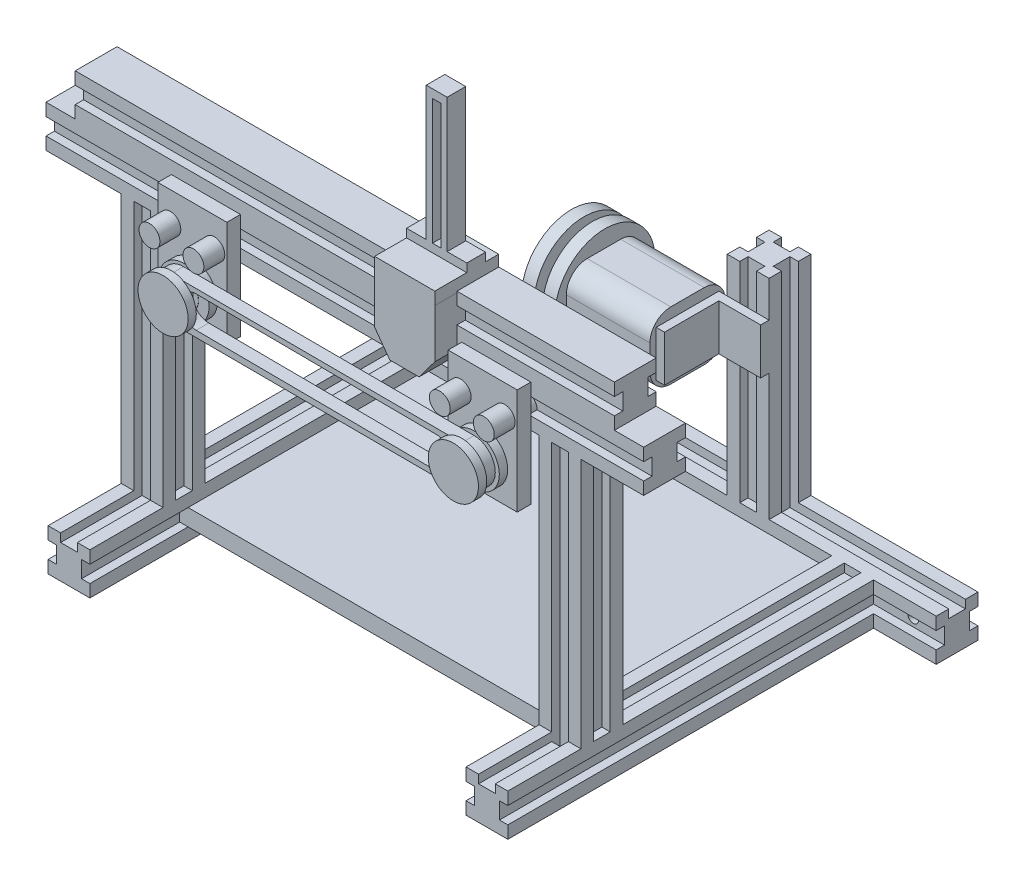
from build123d import *

# Parameters (mm, degrees)
SKETCH_1_W                = 10
SKETCH_1_H                = 35
EXTRUDE_1_DEPTH           = 10
EXTRUDE_2_DEPTH           = 60
EXTRUDE_2_DEPTH_BACK      = 10
SKETCH_2_W                = 10
SKETCH_2_H                = 10
SKETCH_3_W                = 4
SKETCH_3_H                = 35
CUT_EXTRUDE_1_DEPTH       = 2
SKETCH_5_W                = 4
SKETCH_5_H                = 62
CUT_EXTRUDE_2_DEPTH       = 2
SKETCH_6_W                = 10
SKETCH_6_H                = 10
EXTRUDE_3_DEPTH           = 10
SKETCH_7_W                = 10
SKETCH_7_H                = 10
EXTRUDE_4_DEPTH           = 18
SKETCH_9_W                = 10
SKETCH_9_H                = 10
EXTRUDE_6_DEPTH           = 100
SKETCH_10_W               = 4
SKETCH_10_H               = 70
CUT_EXTRUDE_3_DEPTH       = 2
SKETCH_12_W               = 10
SKETCH_12_H               = 10
EXTRUDE_8_DEPTH           = 60
SKETCH_13_W               = 4
SKETCH_13_H               = 60
CUT_EXTRUDE_4_DEPTH       = 2
SKETCH_14_W               = 10
SKETCH_14_H               = 10
EXTRUDE_9_DEPTH           = 10
SKETCH_15_W               = 10
SKETCH_15_H               = 10
EXTRUDE_10_DEPTH          = 15
SKETCH_17_W               = 10
SKETCH_17_H               = 10
EXTRUDE_12_DEPTH          = 100
SKETCH_18_W               = 10
SKETCH_18_H               = 10
EXTRUDE_13_DEPTH          = 50
SKETCH_19_W               = 4
SKETCH_19_H               = 50
CUT_EXTRUDE_5_DEPTH       = 2
SKETCH_21_W               = 12
SKETCH_21_H               = 11
EXTRUDE_14_DEPTH          = 2
SKETCH_22_W               = 2
SKETCH_22_H               = 11
EXTRUDE_15_DEPTH          = 15
SKETCH_26_W               = 10
SKETCH_26_H               = 10
EXTRUDE_18_DEPTH          = 60
SKETCH_27_W               = 10
SKETCH_27_H               = 10
EXTRUDE_19_DEPTH          = 15
SKETCH_29_W               = 90
SKETCH_29_H               = 4
CUT_EXTRUDE_6_DEPTH       = 2
SKETCH_30_W               = 4
SKETCH_30_H               = 50
CUT_EXTRUDE_7_DEPTH       = 2
SKETCH_31_W               = 4
SKETCH_31_H               = 52
CUT_EXTRUDE_8_DEPTH       = 2
SKETCH_32_W               = 42
SKETCH_32_H               = 4
CUT_EXTRUDE_9_DEPTH       = 2
SKETCH_33_W               = 128
SKETCH_33_H               = 4
CUT_EXTRUDE_10_DEPTH      = 2
SKETCH_34_W               = 10
SKETCH_34_H               = 10
EXTRUDE_21_DEPTH          = 72
SKETCH_35_W               = 10
SKETCH_35_H               = 10
EXTRUDE_22_DEPTH          = 15
SKETCH_37_W               = 10
SKETCH_37_H               = 4
CUT_EXTRUDE_11_DEPTH      = 2
SKETCH_38_W               = 4
SKETCH_38_H               = 70
CUT_EXTRUDE_12_DEPTH      = 2
SKETCH_40_W               = 10
SKETCH_40_H               = 10
EXTRUDE_23_DEPTH          = 35
SKETCH_41_W               = 4
SKETCH_41_H               = 35
SKETCH_41_H_2             = 60.179921859
CUT_EXTRUDE_13_DEPTH      = 2
CUT_EXTRUDE_14_DEPTH      = 92
CUT_EXTRUDE_14_DEPTH_BACK = 2
SKETCH_42_W               = 105
SKETCH_42_H               = 4
SKETCH_43_W               = 4
SKETCH_43_H               = 60
CUT_EXTRUDE_15_DEPTH      = 2
CUT_EXTRUDE_17_DEPTH      = 92
CUT_EXTRUDE_17_DEPTH_BACK = 2
SKETCH_45_W               = 4
SKETCH_45_H               = 60
SKETCH_48_W               = 143
SKETCH_48_H               = 4
SKETCH_48_W_2             = 140
SKETCH_48_W_3             = 4
SKETCH_48_H_2             = 50
CUT_EXTRUDE_19_DEPTH      = 2
SKETCH_49_W               = 143.017292897
SKETCH_49_H               = 4
CUT_EXTRUDE_20_DEPTH      = 2
SKETCH_50_W               = 94
SKETCH_50_H               = 4
CUT_EXTRUDE_21_DEPTH      = 2
SKETCH_51_W               = 5
SKETCH_51_H               = 4
CUT_EXTRUDE_22_DEPTH      = 2
CUT_EXTRUDE_25_DEPTH      = 24
CUT_EXTRUDE_25_DEPTH_BACK = 2
SKETCH_54_W               = 107
SKETCH_54_H               = 4
CUT_EXTRUDE_26_DEPTH      = 24
CUT_EXTRUDE_26_DEPTH_BACK = 2
SKETCH_55_W               = 107
SKETCH_55_H               = 4
SKETCH_56_R               = 1.25
CUT_EXTRUDE_27_DEPTH      = 81
SKETCH_57_W               = 4
SKETCH_57_H               = 59.985558993
CUT_EXTRUDE_28_DEPTH      = 2
SKETCH_64_W               = 94
SKETCH_64_H               = 4
EXTRUDE_29_DEPTH          = 66
SKETCH_65_W               = 110
SKETCH_65_H               = 17.5
CUT_EXTRUDE_30_DEPTH      = 175.086903586
SKETCH_66_W               = 16.527417389
SKETCH_66_H               = 25.328727671
EXTRUDE_30_DEPTH          = 6.5
SKETCH_68_W               = 16.527417389
SKETCH_68_H               = 3.25
CUT_EXTRUDE_32_DEPTH      = 175.086903586
SKETCH_69_R               = 2.5
EXTRUDE_31_DEPTH          = 5
SKETCH_70_R               = 6
EXTRUDE_32_DEPTH          = 2
SKETCH_71_R               = 3.5
EXTRUDE_33_DEPTH          = 3
SKETCH_72_R               = 6
EXTRUDE_34_DEPTH          = 2
SKETCH_78_W               = 16.53
SKETCH_78_H               = 3.25
EXTRUDE_38_DEPTH          = 29
EXTRUDE_39_DEPTH          = 5
EXTRUDE_39_DEPTH_BACK     = 9
SKETCH_79_R               = 2.5
SKETCH_80_W               = 16.53
SKETCH_80_H               = 3.671272329
CUT_EXTRUDE_33_DEPTH      = 5
SKETCH_84_R               = 6
EXTRUDE_43_DEPTH          = 2
SKETCH_85_R               = 3.5
EXTRUDE_44_DEPTH          = 3
SKETCH_86_R               = 6
EXTRUDE_45_DEPTH          = 2
EXTRUDE_46_DEPTH          = 3
CUT_EXTRUDE_34_DEPTH      = 3
SKETCH_90_W               = 129.003731319
SKETCH_90_H               = 10
EXTRUDE_47_DEPTH          = 10
SKETCH_91_W               = 129.750613008
SKETCH_91_H               = 4
CUT_EXTRUDE_35_DEPTH      = 2
SKETCH_92_W               = 134.507780813
SKETCH_92_H               = 4
CUT_EXTRUDE_36_DEPTH      = 2
EXTRUDE_49_DEPTH          = 12
SKETCH_95_W               = 14.403024518
SKETCH_95_H               = 5.3
EXTRUDE_50_DEPTH          = 3
SKETCH_96_W               = 14.403024518
SKETCH_96_H               = 2.667341582
EXTRUDE_51_DEPTH          = 10
SKETCH_97_W               = 14.403024518
SKETCH_97_H               = 4.481182928
EXTRUDE_52_DEPTH          = 2
SKETCH_98_W               = 5
SKETCH_98_H               = 4.446887226
EXTRUDE_53_DEPTH          = 32
SKETCH_99_W               = 18
SKETCH_99_H               = 16
EXTRUDE_54_DEPTH          = 20
FILLET_1_R                = 5
SKETCH_100_R              = 11.938572067
EXTRUDE_55_DEPTH          = 3
SKETCH_101_R              = 7.602426979
EXTRUDE_56_DEPTH          = 2
SKETCH_102_R              = 11.938572067
EXTRUDE_57_DEPTH          = 3
SKETCH_103_R              = 7.369837634
EXTRUDE_58_DEPTH          = 3
SKETCH_104_W              = 5.901682188
SKETCH_104_H              = 2.792537945
CUT_EXTRUDE_37_DEPTH      = 69
SKETCH_106_W              = 2
SKETCH_106_H              = 30
CUT_EXTRUDE_38_DEPTH      = 10


with BuildPart() as part:
    # 草圖1 → 填料-伸長1 (new body)
    with BuildSketch(Plane(origin=(0, 0, 0), x_dir=(1, 0, 0), z_dir=(0, 1, 0))):
        Rectangle(SKETCH_1_W, SKETCH_1_H)
    extrude(amount=EXTRUDE_1_DEPTH)

    # 草圖2 → 填料-伸長2 (add, two sides: drawn at the far end of the back side and taken through both)
    with BuildSketch(Plane(origin=(0, 10, 0), x_dir=(1, 0, 0), z_dir=(0, 1, 0)).offset(-EXTRUDE_2_DEPTH_BACK)):
        with Locations((0, 22.5)):
            Rectangle(SKETCH_2_W, SKETCH_2_H)
    extrude(amount=EXTRUDE_2_DEPTH + EXTRUDE_2_DEPTH_BACK)

    # 草圖3 → 除料-伸長1 (cut)
    with BuildSketch(Plane(origin=(0, 10, 0), x_dir=(1, 0, 0), z_dir=(0, 1, 0))):
        Rectangle(SKETCH_3_W, SKETCH_3_H)
    extrude(amount=-CUT_EXTRUDE_1_DEPTH, mode=Mode.SUBTRACT)

    # 草圖5 → 除料-伸長2 (cut)
    with BuildSketch(Plane.XY.offset(-17.5)):
        with Locations((0, 39)):
            Rectangle(SKETCH_5_W, SKETCH_5_H)
    extrude(amount=-CUT_EXTRUDE_2_DEPTH, mode=Mode.SUBTRACT)

    # 草圖6 → 填料-伸長3 (add)
    with BuildSketch(Plane(origin=(0, 70, 0), x_dir=(1, 0, 0), z_dir=(0, 1, 0))):
        with Locations((0, 22.5)):
            Rectangle(SKETCH_6_W, SKETCH_6_H)
    extrude(amount=EXTRUDE_3_DEPTH)

    # 草圖7 → 填料-伸長4 (add)
    with BuildSketch(Plane.ZY.offset(5)):
        with Locations((-22.5, 75)):
            Rectangle(SKETCH_7_W, SKETCH_7_H)
    extrude(amount=EXTRUDE_4_DEPTH)

    # 草圖9 → 填料-伸長6 (add)
    with BuildSketch(Plane(origin=(5, 0, 0), x_dir=(0, 0, -1), z_dir=(1, 0, 0))):
        with Locations((22.5, 75)):
            Rectangle(SKETCH_9_W, SKETCH_9_H)
    extrude(amount=EXTRUDE_6_DEPTH)

    # 草圖10 → 除料-伸長3 (cut)
    with BuildSketch(Plane(origin=(0, 0, -27.5), x_dir=(-1, 0, 0), z_dir=(0, 0, -1))):
        with Locations((0, 35)):
            Rectangle(SKETCH_10_W, SKETCH_10_H)
    extrude(amount=-CUT_EXTRUDE_3_DEPTH, mode=Mode.SUBTRACT)

    # 草圖12 → 填料-伸長8 (add)
    with BuildSketch(Plane(origin=(0, 0, -27.5), x_dir=(-1, 0, 0), z_dir=(0, 0, -1))):
        with Locations((0, 5)):
            Rectangle(SKETCH_12_W, SKETCH_12_H)
    extrude(amount=EXTRUDE_8_DEPTH)

    # 草圖13 → 除料-伸長4 (cut)
    with BuildSketch(Plane(origin=(0, 10, 0), x_dir=(1, 0, 0), z_dir=(0, 1, 0))):
        with Locations((0, 57.5)):
            Rectangle(SKETCH_13_W, SKETCH_13_H)
    extrude(amount=-CUT_EXTRUDE_4_DEPTH, mode=Mode.SUBTRACT)

    # 草圖14 → 填料-伸長9 (add)
    with BuildSketch(Plane(origin=(0, 0, -87.5), x_dir=(-1, 0, 0), z_dir=(0, 0, -1))):
        with Locations((0, 5)):
            Rectangle(SKETCH_14_W, SKETCH_14_H)
    extrude(amount=EXTRUDE_9_DEPTH)

    # 草圖15 → 填料-伸長10 (add)
    with BuildSketch(Plane.ZY.offset(5)):
        with Locations((-92.5, 5)):
            Rectangle(SKETCH_15_W, SKETCH_15_H)
    extrude(amount=EXTRUDE_10_DEPTH)

    # 草圖17 → 填料-伸長12 (add)
    with BuildSketch(Plane(origin=(5, 0, 0), x_dir=(0, 0, -1), z_dir=(1, 0, 0))):
        with Locations((92.5, 5)):
            Rectangle(SKETCH_17_W, SKETCH_17_H)
    extrude(amount=EXTRUDE_12_DEPTH)

    # 草圖18 → 填料-伸長13 (add)
    with BuildSketch(Plane(origin=(0, 10, 0), x_dir=(1, 0, 0), z_dir=(0, 1, 0))):
        with Locations((75, 92.5)):
            Rectangle(SKETCH_18_W, SKETCH_18_H)
    extrude(amount=EXTRUDE_13_DEPTH)

    # 草圖19 → 除料-伸長5 (cut)
    with BuildSketch(Plane.XY.offset(-87.5)):
        with Locations((75, 35)):
            Rectangle(SKETCH_19_W, SKETCH_19_H)
    extrude(amount=-CUT_EXTRUDE_5_DEPTH, mode=Mode.SUBTRACT)

    # 草圖21 → 填料-伸長14 (add)
    with BuildSketch(Plane.XY.offset(-87.5)):
        with Locations((74, 45.84296249)):
            Rectangle(SKETCH_21_W, SKETCH_21_H)
    extrude(amount=EXTRUDE_14_DEPTH)

    # 草圖22 → 填料-伸長15 (add)
    with BuildSketch(Plane(origin=(0, 0, -87.5), x_dir=(-1, 0, 0), z_dir=(0, 0, -1))):
        with Locations((-69, 45.84296249)):
            Rectangle(SKETCH_22_W, SKETCH_22_H)
    extrude(amount=-EXTRUDE_15_DEPTH)

    # 草圖26 → 填料-伸長18 (add)
    with BuildSketch(Plane.XY.offset(-87.5)):
        with Locations((100, 5)):
            Rectangle(SKETCH_26_W, SKETCH_26_H)
    extrude(amount=EXTRUDE_18_DEPTH)

    # 草圖27 → 填料-伸長19 (add)
    with BuildSketch(Plane(origin=(105, 0, 0), x_dir=(0, 0, -1), z_dir=(1, 0, 0))):
        with Locations((92.5, 5)):
            Rectangle(SKETCH_27_W, SKETCH_27_H)
    extrude(amount=EXTRUDE_19_DEPTH)

    # 草圖29 → 除料-伸長6 (cut)
    with BuildSketch(Plane(origin=(0, 10, 0), x_dir=(1, 0, 0), z_dir=(0, 1, 0))):
        with Locations((25, 92.5)):
            Rectangle(SKETCH_29_W, SKETCH_29_H)
    extrude(amount=-CUT_EXTRUDE_6_DEPTH, mode=Mode.SUBTRACT)

    # 草圖30 → 除料-伸長7 (cut)
    with BuildSketch(Plane(origin=(80, 0, 0), x_dir=(0, 0, -1), z_dir=(1, 0, 0))):
        with Locations((92.5, 35)):
            Rectangle(SKETCH_30_W, SKETCH_30_H)
    extrude(amount=-CUT_EXTRUDE_7_DEPTH, mode=Mode.SUBTRACT)

    # 草圖31 → 除料-伸長8 (cut)
    with BuildSketch(Plane.ZY.offset(-70)):
        with Locations((-92.5, 34)):
            Rectangle(SKETCH_31_W, SKETCH_31_H)
    extrude(amount=-CUT_EXTRUDE_8_DEPTH, mode=Mode.SUBTRACT)

    # 草圖32 → 除料-伸長9 (cut)
    with BuildSketch(Plane(origin=(0, 10, 0), x_dir=(1, 0, 0), z_dir=(0, 1, 0))):
        with Locations((99, 92.5)):
            Rectangle(SKETCH_32_W, SKETCH_32_H)
    extrude(amount=-CUT_EXTRUDE_9_DEPTH, mode=Mode.SUBTRACT)

    # 草圖33 → 除料-伸長10 (cut)
    with BuildSketch(Plane.XY.offset(-17.5)):
        with Locations((41, 75)):
            Rectangle(SKETCH_33_W, SKETCH_33_H)
    extrude(amount=-CUT_EXTRUDE_10_DEPTH, mode=Mode.SUBTRACT)

    # 草圖34 → 填料-伸長21 (add)
    with BuildSketch(Plane.XZ):
        with Locations((100, -22.5)):
            Rectangle(SKETCH_34_W, SKETCH_34_H)
    extrude(amount=-EXTRUDE_21_DEPTH)

    # 草圖35 → 填料-伸長22 (add)
    with BuildSketch(Plane(origin=(105, 0, 0), x_dir=(0, 0, -1), z_dir=(1, 0, 0))):
        with Locations((22.5, 75)):
            Rectangle(SKETCH_35_W, SKETCH_35_H)
    extrude(amount=EXTRUDE_22_DEPTH)

    # 草圖37 → 除料-伸長11 (cut)
    with BuildSketch(Plane.XY.offset(-17.5)):
        with Locations((110, 75)):
            Rectangle(SKETCH_37_W, SKETCH_37_H)
    extrude(amount=-CUT_EXTRUDE_11_DEPTH, mode=Mode.SUBTRACT)

    # 草圖38 → 除料-伸長12 (cut)
    with BuildSketch(Plane.XY.offset(-17.5)):
        with Locations((100, 35)):
            Rectangle(SKETCH_38_W, SKETCH_38_H)
    extrude(amount=-CUT_EXTRUDE_12_DEPTH, mode=Mode.SUBTRACT)

    # 草圖40 → 填料-伸長23 (add)
    with BuildSketch(Plane.XY.offset(-17.5)):
        with Locations((100, 5)):
            Rectangle(SKETCH_40_W, SKETCH_40_H)
    extrude(amount=EXTRUDE_23_DEPTH)

    # 草圖41 → 除料-伸長13 (cut)
    with BuildSketch(Plane(origin=(0, 10, 0), x_dir=(1, 0, 0), z_dir=(0, 1, 0))):
        with Locations((100, 0)):
            Rectangle(SKETCH_41_W, SKETCH_41_H)
        with Locations((100, 57.410039071)):
            Rectangle(SKETCH_41_W, SKETCH_41_H_2)
    extrude(amount=-CUT_EXTRUDE_13_DEPTH, mode=Mode.SUBTRACT)

    # 草圖42 → 除料-伸長14 (cut, two sides: drawn at the far end of the back side and taken through both)
    with BuildSketch(Plane(origin=(5, 0, 0), x_dir=(0, 0, -1), z_dir=(1, 0, 0)).offset(-CUT_EXTRUDE_14_DEPTH_BACK)):
        with Locations((35, 5)):
            Rectangle(SKETCH_42_W, SKETCH_42_H)
    extrude(amount=CUT_EXTRUDE_14_DEPTH + CUT_EXTRUDE_14_DEPTH_BACK, mode=Mode.SUBTRACT)

    # 草圖43 → 除料-伸長15 (cut)
    with BuildSketch(Plane(origin=(0, 0, -27.5), x_dir=(-1, 0, 0), z_dir=(0, 0, -1))):
        with Locations((-100, 40)):
            Rectangle(SKETCH_43_W, SKETCH_43_H)
    extrude(amount=-CUT_EXTRUDE_15_DEPTH, mode=Mode.SUBTRACT)

    # 草圖45 → 除料-伸長17 (cut, two sides: drawn at the far end of the back side and taken through both)
    with BuildSketch(Plane(origin=(5, 0, 0), x_dir=(0, 0, -1), z_dir=(1, 0, 0)).offset(-CUT_EXTRUDE_17_DEPTH_BACK)):
        with Locations((22.5, 40)):
            Rectangle(SKETCH_45_W, SKETCH_45_H)
    extrude(amount=CUT_EXTRUDE_17_DEPTH + CUT_EXTRUDE_17_DEPTH_BACK, mode=Mode.SUBTRACT)

    # 草圖48 → 除料-伸長19 (cut)
    with BuildSketch(Plane(origin=(0, 0, -97.5), x_dir=(-1, 0, 0), z_dir=(0, 0, -1))):
        with Locations((-48.5, 75)):
            Rectangle(SKETCH_48_W, SKETCH_48_H)
        with Locations((-50, 5)):
            Rectangle(SKETCH_48_W_2, SKETCH_48_H)
        with Locations((-75, 35)):
            Rectangle(SKETCH_48_W_3, SKETCH_48_H_2)
    extrude(amount=-CUT_EXTRUDE_19_DEPTH, mode=Mode.SUBTRACT)

    # 草圖49 → 除料-伸長20 (cut)
    with BuildSketch(Plane(origin=(0, 0, -27.5), x_dir=(-1, 0, 0), z_dir=(0, 0, -1))):
        with Locations((-48.508646449, 75)):
            Rectangle(SKETCH_49_W, SKETCH_49_H)
    extrude(amount=-CUT_EXTRUDE_20_DEPTH, mode=Mode.SUBTRACT)

    # 草圖50 → 除料-伸長21 (cut)
    with BuildSketch(Plane.XY.offset(-87.5)):
        with Locations((50, 5)):
            Rectangle(SKETCH_50_W, SKETCH_50_H)
    extrude(amount=-CUT_EXTRUDE_21_DEPTH, mode=Mode.SUBTRACT)

    # 草圖51 → 除料-伸長22 (cut)
    with BuildSketch(Plane.XY.offset(-17.5)):
        with Locations((117.5, 75)):
            Rectangle(SKETCH_51_W, SKETCH_51_H)
    extrude(amount=-CUT_EXTRUDE_22_DEPTH, mode=Mode.SUBTRACT)

    # 草圖54 → 除料-伸長25 (cut, two sides: drawn at the far end of the back side and taken through both)
    with BuildSketch(Plane(origin=(105, 0, 0), x_dir=(0, 0, -1), z_dir=(1, 0, 0)).offset(-CUT_EXTRUDE_25_DEPTH_BACK)):
        with Locations((36, 5)):
            Rectangle(SKETCH_54_W, SKETCH_54_H)
    extrude(amount=CUT_EXTRUDE_25_DEPTH + CUT_EXTRUDE_25_DEPTH_BACK, mode=Mode.SUBTRACT)

    # 草圖55 → 除料-伸長26 (cut, two sides: drawn at the far end of the back side and taken through both)
    with BuildSketch(Plane.ZY.offset(5).offset(-CUT_EXTRUDE_26_DEPTH_BACK)):
        with Locations((-36, 5)):
            Rectangle(SKETCH_55_W, SKETCH_55_H)
    extrude(amount=CUT_EXTRUDE_26_DEPTH + CUT_EXTRUDE_26_DEPTH_BACK, mode=Mode.SUBTRACT)

    # 草圖56 → 除料-伸長27 (cut)
    with BuildSketch(Plane.XY.offset(-17.5)):
        with Locations((-12.5, 5)):
            Circle(SKETCH_56_R)
        with Locations((112.5, 5)):
            Circle(SKETCH_56_R)
    extrude(amount=-CUT_EXTRUDE_27_DEPTH, mode=Mode.SUBTRACT)

    # 草圖57 → 除料-伸長28 (cut)
    with BuildSketch(Plane(origin=(105, 0, 0), x_dir=(0, 0, -1), z_dir=(1, 0, 0))):
        with Locations((22.5, 40.007220504)):
            Rectangle(SKETCH_57_W, SKETCH_57_H)
    extrude(amount=-CUT_EXTRUDE_28_DEPTH, mode=Mode.SUBTRACT)

    # 草圖64 → 填料-伸長29 (add)
    with BuildSketch(Plane.XY.offset(-89.5)):
        with Locations((50, 5)):
            Rectangle(SKETCH_64_W, SKETCH_64_H)
    extrude(amount=EXTRUDE_29_DEPTH)

    # 草圖65 → 除料-伸長30 (cut, through all)
    with BuildSketch(Plane(origin=(0, 80, 0), x_dir=(1, 0, 0), z_dir=(0, 1, 0))):
        with Locations((50, -8.75)):
            Rectangle(SKETCH_65_W, SKETCH_65_H)
    extrude(amount=-CUT_EXTRUDE_30_DEPTH, mode=Mode.SUBTRACT)

    # 草圖66 → 填料-伸長30 (add)
    with BuildSketch(Plane.XY.offset(-11)):
        with Locations((15.263708695, 67.335636165)):
            Rectangle(SKETCH_66_W, SKETCH_66_H)
    extrude(amount=-EXTRUDE_30_DEPTH)

    # 草圖68 → 除料-伸長32 (cut, through all)
    with BuildSketch(Plane(origin=(0, 80, 0), x_dir=(1, 0, 0), z_dir=(0, 1, 0))):
        with Locations((15.263708695, 12.625)):
            Rectangle(SKETCH_68_W, SKETCH_68_H)
    extrude(amount=-CUT_EXTRUDE_32_DEPTH, mode=Mode.SUBTRACT)

    # 草圖69 → 填料-伸長31 (add)
    with BuildSketch(Plane.XY.offset(-14.25)):
        with Locations((10, 73)):
            Circle(SKETCH_69_R)
        with Locations((20.527417389, 73)):
            Circle(SKETCH_69_R)
    extrude(amount=EXTRUDE_31_DEPTH)

    # 草圖70 → 填料-伸長32 (add)
    with BuildSketch(Plane.XY.offset(-14.25)):
        with Locations((15.263708694, 62.355056913)):
            Circle(SKETCH_70_R)
    extrude(amount=EXTRUDE_32_DEPTH)

    # 草圖71 → 填料-伸長33 (add)
    with BuildSketch(Plane.XY.offset(-12.25)):
        with Locations((15.263708694, 62.355056913)):
            Circle(SKETCH_71_R)
    extrude(amount=EXTRUDE_33_DEPTH)

    # 草圖72 → 填料-伸長34 (add)
    with BuildSketch(Plane.XY.offset(-9.25)):
        with Locations((15.263708694, 62.355056913)):
            Circle(SKETCH_72_R)
    extrude(amount=EXTRUDE_34_DEPTH)

    # 草圖78 → 填料-伸長38 (add)
    with BuildSketch(Plane(origin=(0, 80, 0), x_dir=(1, 0, 0), z_dir=(0, 1, 0))):
        with Locations((84.735, 15.875)):
            Rectangle(SKETCH_78_W, SKETCH_78_H)
    extrude(amount=-EXTRUDE_38_DEPTH)

    # 草圖79 → 填料-伸長39 (add, two sides: drawn at the far end of the back side and taken through both)
    with BuildSketch(Plane.XY.offset(-14.25).offset(-EXTRUDE_39_DEPTH_BACK)):
        with Locations((79.47, 73)):
            Circle(SKETCH_79_R)
        with Locations((90, 73)):
            Circle(SKETCH_79_R)
    extrude(amount=EXTRUDE_39_DEPTH + EXTRUDE_39_DEPTH_BACK)

    # 草圖80 → 除料-伸長33 (cut)
    with BuildSketch(Plane.XY.offset(-14.25)):
        with Locations((84.735, 52.835636165)):
            Rectangle(SKETCH_80_W, SKETCH_80_H)
    extrude(amount=-CUT_EXTRUDE_33_DEPTH, mode=Mode.SUBTRACT)

    # 草圖84 → 填料-伸長43 (add)
    with BuildSketch(Plane.XY.offset(-14.25)):
        with Locations((84.71421608, 62.355056913)):
            Circle(SKETCH_84_R)
    extrude(amount=EXTRUDE_43_DEPTH)

    # 草圖85 → 填料-伸長44 (add)
    with BuildSketch(Plane.XY.offset(-12.25)):
        with Locations((84.698234345, 62.379481468)):
            Circle(SKETCH_85_R)
    extrude(amount=EXTRUDE_44_DEPTH)

    # 草圖86 → 填料-伸長45 (add)
    with BuildSketch(Plane.XY.offset(-9.25)):
        with Locations((84.71421608, 62.355056913)):
            Circle(SKETCH_86_R)
    extrude(amount=EXTRUDE_45_DEPTH)

    # 草圖87 → 填料-伸長46 (add)
    with BuildSketch(Plane.XY.offset(-12.2)):
        with BuildLine():
            Line((15.181521767, 67.668986282), (84.730999511, 67.439403419))
            ThreePointArc((84.730999511, 67.439403419), (89.798562585, 62.338273483), (84.69743265, 57.270710408))
            Line((84.69743265, 57.270710408), (15.147954906, 57.500293272))
            ThreePointArc((15.147954906, 57.500293272), (10.080391831, 62.601423208), (15.181521767, 67.668986282))
        make_face()
    extrude(amount=EXTRUDE_46_DEPTH)

    # 草圖89 → 除料-伸長34 (cut)
    with BuildSketch(Plane.XY.offset(-9.2)):
        with BuildLine():
            Line((21.275250265, 66.537656765), (78.740156013, 66.142514841))
            ThreePointArc((78.740156013, 66.142514841), (82.481900803, 62.348955566), (78.688341527, 58.607210776))
            Line((78.688341527, 58.607210776), (21.223435779, 59.002352699))
            ThreePointArc((21.223435779, 59.002352699), (17.481690989, 62.795911975), (21.275250265, 66.537656765))
        make_face()
    extrude(amount=-CUT_EXTRUDE_34_DEPTH, mode=Mode.SUBTRACT)

    # 草圖90 → 填料-伸長47 (add)
    with BuildSketch(Plane(origin=(0, 80, 0), x_dir=(1, 0, 0), z_dir=(0, 1, 0))):
        with Locations((48.498134341, 22.5)):
            Rectangle(SKETCH_90_W, SKETCH_90_H)
    extrude(amount=EXTRUDE_47_DEPTH)

    # 草圖91 → 除料-伸長35 (cut)
    with BuildSketch(Plane.XY.offset(-17.5)):
        with Locations((48.124693496, 85)):
            Rectangle(SKETCH_91_W, SKETCH_91_H)
    extrude(amount=-CUT_EXTRUDE_35_DEPTH, mode=Mode.SUBTRACT)

    # 草圖92 → 除料-伸長36 (cut)
    with BuildSketch(Plane(origin=(0, 0, -27.5), x_dir=(-1, 0, 0), z_dir=(0, 0, -1))):
        with Locations((-47.416603995, 85)):
            Rectangle(SKETCH_92_W, SKETCH_92_H)
    extrude(amount=-CUT_EXTRUDE_36_DEPTH, mode=Mode.SUBTRACT)

    # 草圖94 → 填料-伸長49 (add)
    with BuildSketch(Plane.XY.offset(-12.2)):
        Polygon((60.924961166, 89.667341582), (75.319733248, 89.667341582), (75.319733248, 78), (71.561535165, 73), (64.561535165, 73), (60.924961166, 78), align=None)
    extrude(amount=-EXTRUDE_49_DEPTH)

    # 草圖95 → 填料-伸長50 (add)
    with BuildSketch(Plane(origin=(0, 89.667341582, 0), x_dir=(1, 0, 0), z_dir=(0, 1, 0))):
        with Locations((68.126473425, 14.85)):
            Rectangle(SKETCH_95_W, SKETCH_95_H)
    extrude(amount=EXTRUDE_50_DEPTH)

    # 草圖96 → 填料-伸長51 (add)
    with BuildSketch(Plane(origin=(0, 0, -17.5), x_dir=(-1, 0, 0), z_dir=(0, 0, -1))):
        with Locations((-68.126473425, 91.333670791)):
            Rectangle(SKETCH_96_W, SKETCH_96_H)
    extrude(amount=EXTRUDE_51_DEPTH)

    # 草圖97 → 填料-伸長52 (add)
    with BuildSketch(Plane(origin=(0, 92.667341582, 0), x_dir=(1, 0, 0), z_dir=(0, 1, 0))):
        with Locations((68.126473425, 22.090591464)):
            Rectangle(SKETCH_97_W, SKETCH_97_H)
    extrude(amount=EXTRUDE_52_DEPTH)

    # 草圖98 → 填料-伸長53 (add)
    with BuildSketch(Plane(origin=(0, 94.667341582, 0), x_dir=(1, 0, 0), z_dir=(0, 1, 0))):
        with Locations((68.126473425, 22.073443613)):
            Rectangle(SKETCH_98_W, SKETCH_98_H)
    extrude(amount=EXTRUDE_53_DEPTH)

    # 草圖99 → 填料-伸長54 (add)
    with BuildSketch(Plane.ZY.offset(-68)):
        with Locations((-80, 45.84296249)):
            Rectangle(SKETCH_99_W, SKETCH_99_H)
    extrude(amount=EXTRUDE_54_DEPTH)

    # 圓角1
    fillet_1_edges = [part.edges().sort_by_distance(p)[0] for p in [
        (58, 37.84296249, -89),
        (58, 37.84296249, -71),
        (58, 53.84296249, -89),
        (58, 53.84296249, -71),
    ]]
    fillet(fillet_1_edges, radius=FILLET_1_R)

    # 草圖100 → 填料-伸長55 (add)
    with BuildSketch(Plane.ZY.offset(-48)):
        with Locations((-80.228318485, 45.974721713)):
            Circle(SKETCH_100_R)
    extrude(amount=EXTRUDE_55_DEPTH)

    # 草圖101 → 填料-伸長56 (add)
    with BuildSketch(Plane.ZY.offset(-45)):
        with Locations((-80.228318485, 45.974721713)):
            Circle(SKETCH_101_R)
    extrude(amount=EXTRUDE_56_DEPTH)

    # 草圖102 → 填料-伸長57 (add)
    with BuildSketch(Plane.ZY.offset(-43)):
        with Locations((-80.228318485, 45.974721713)):
            Circle(SKETCH_102_R)
    extrude(amount=EXTRUDE_57_DEPTH)

    # 草圖103 → 填料-伸長58 (add)
    with BuildSketch(Plane.ZY.offset(-40)):
        with Locations((-80.228318485, 45.974721713)):
            Circle(SKETCH_103_R)
    extrude(amount=EXTRUDE_58_DEPTH)

    # 草圖104 → 除料-伸長37 (cut)
    with BuildSketch(Plane.XY.offset(-12.2)):
        with Locations((37.049158906, 47.77439663)):
            Rectangle(SKETCH_104_W, SKETCH_104_H)
    extrude(amount=-CUT_EXTRUDE_37_DEPTH, mode=Mode.SUBTRACT)

    # 草圖106 → 除料-伸長38 (cut)
    with BuildSketch(Plane.XY.offset(-19.85)):
        with Locations((68.126473425, 109.667341582)):
            Rectangle(SKETCH_106_W, SKETCH_106_H)
    extrude(amount=-CUT_EXTRUDE_38_DEPTH, mode=Mode.SUBTRACT)


solid = part.part
